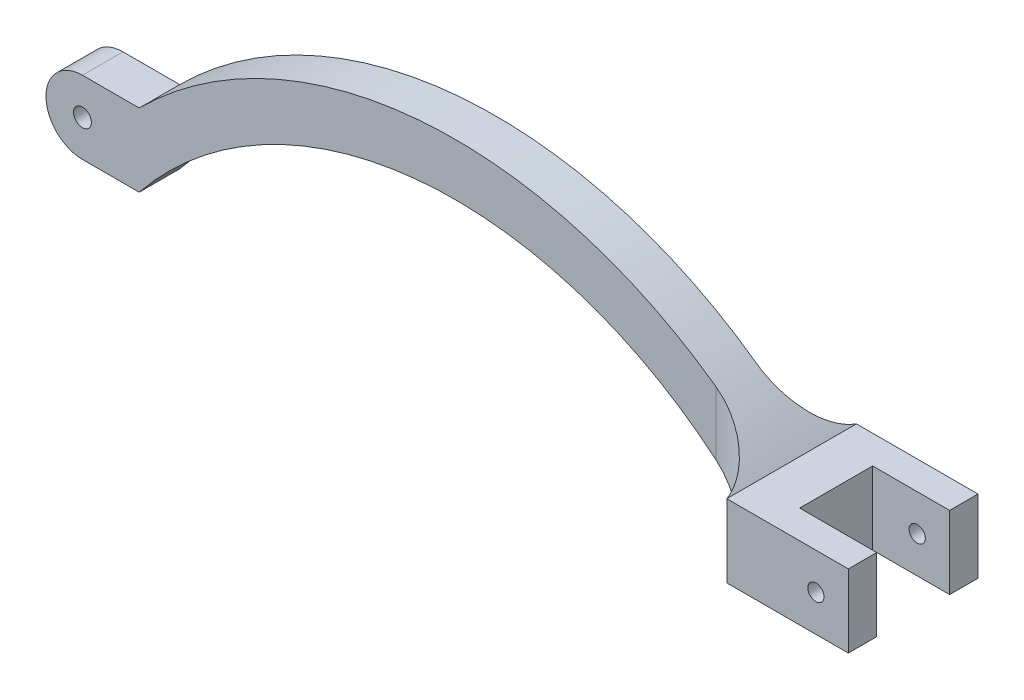
from build123d import *

# Parameters (mm, degrees)
SKETCH1_R           = 1.1
BOSS_EXTRUDE1_DEPTH = 5
BOSS_EXTRUDE2_DEPTH = 5
BOSS_EXTRUDE3_DEPTH = 9
SKETCH5_R           = 1
CUT_EXTRUDE1_DEPTH  = 16
SKETCH6_R           = 1.9
CUT_EXTRUDE2_DEPTH  = 1
FILLET1_R           = 0.5
SKETCH7_W           = 5
SKETCH7_H           = 16
BOSS_EXTRUDE4_DEPTH = 9
FILLET2_R           = 7


with BuildPart() as part:
    # Sketch1 → Boss-Extrude1 (new body)
    with BuildSketch(Plane.XY):
        with BuildLine():
            ThreePointArc((0, 4.5), (-4.5, 0), (0, -4.5))
            Line((0, -4.5), (7, -4.5))
            ThreePointArc((7, -4.5), (42.961642557, 14.118622766), (80.916317371, 0))
            Line((80.916317371, 0), (90, 0))
            Line((90, 0), (90, 4.5))
            Line((90, 4.5), (85, 4.5))
            ThreePointArc((85, 4.5), (46, 20.654328933), (7, 4.5))
            Line((7, 4.5), (0, 4.5))
        make_face()
        Circle(SKETCH1_R, mode=Mode.SUBTRACT)
    extrude(amount=BOSS_EXTRUDE1_DEPTH)

    # Sketch3 → Boss-Extrude2 (add)
    with BuildSketch(Plane.XY.offset(5)):
        Polygon((90, 0), (90, -4.5), (85, -4.5), (80.916317371, 0), align=None)
    extrude(amount=-BOSS_EXTRUDE2_DEPTH)

    # Sketch4 → Boss-Extrude3 (add)
    with BuildSketch(Plane(origin=(0, 4.5, 0), x_dir=(1, 0, 0), z_dir=(0, 1, 0))):
        Polygon((90.5, 2), (100, 2), (100, 5.5), (90, 5.5), (90, 0), (90, -5), (90, -10.5), (100, -10.5), (100, -7), (90.5, -7), align=None)
    extrude(amount=-BOSS_EXTRUDE3_DEPTH)

    # Sketch5 → Cut-Extrude1 (cut)
    with BuildSketch(Plane(origin=(0, 0, -5.5), x_dir=(-1, 0, 0), z_dir=(0, 0, -1))):
        with Locations((-96, 0)):
            Circle(SKETCH5_R)
    extrude(amount=-CUT_EXTRUDE1_DEPTH, mode=Mode.SUBTRACT)

    # Sketch6 → Cut-Extrude2 (cut)
    with BuildSketch(Plane(origin=(0, 0, -5.5), x_dir=(-1, 0, 0), z_dir=(0, 0, -1))):
        with Locations((-96, 0)):
            Circle(SKETCH6_R)
    extrude(amount=-CUT_EXTRUDE2_DEPTH, mode=Mode.SUBTRACT)

    # Fillet1
    fillet1_edges = [part.edges().sort_by_distance(p)[0] for p in [
        (97, 0, 7),
    ]]
    fillet(fillet1_edges, radius=FILLET1_R)

    # Sketch7 → Boss-Extrude4 (add)
    with BuildSketch(Plane.XZ.offset(4.5)):
        with Locations((87.5, 2.5)):
            Rectangle(SKETCH7_W, SKETCH7_H)
    extrude(amount=-BOSS_EXTRUDE4_DEPTH)

    # Fillet2
    # the kernel refuses this fillet: 7 mm, written as the material it adds along each edge
    with BuildSketch(Plane(origin=(85, 21.593492914, 0), x_dir=(0, 0, -1), z_dir=(0, -1, 0))) as fillet2_piece_1_section:
        with BuildLine():
            CenterArc((7, -6.837397166), FILLET2_R, 102.373625116, 77.626374884)
            Line((0, -6.837397166), (0, 0))
            Line((0, 0), (5.5, 0))
        make_face()
    fillet2_piece_1 = extrude(amount=43.186985828, mode=Mode.PRIVATE)
    fillet2_piece_1 = fillet2_piece_1 & Plane(origin=(46, -34.5, 0), x_dir=(0.7071067811865476, 0.7071067811865476, 0), z_dir=(0, 0, -1)) * Cylinder(55.154328933, 114, mode=Mode.PRIVATE)
    fillet2_piece_1 = split(fillet2_piece_1, bisect_by=Plane(origin=(72.014490495, 9.809337449, 0), z_dir=(0.7405316990978602, 0.6720214301874877, 0)), keep=Keep.TOP, mode=Mode.PRIVATE)
    add(fillet2_piece_1)
    with BuildSketch(Plane(origin=(85, 4.5, 0), x_dir=(0, 0, -1), z_dir=(0, -1, 0))) as fillet2_piece_2_section:
        with BuildLine():
            CenterArc((7, -6.837397166), FILLET2_R, 102.373625116, 77.626374884)
            Line((0, -6.837397166), (0, 0))
            Line((0, 0), (5.5, 0))
        make_face()
    fillet2_piece_2 = extrude(amount=26.093492914, mode=Mode.PRIVATE)
    fillet2_piece_2 = fillet2_piece_2 - Plane(origin=(46, -35.788975694, 0), x_dir=(-0.7799999999999994, 0.6257795138864816, 0), z_dir=(0, 0, -1)) * Cylinder(50, 80, mode=Mode.PRIVATE)
    add(fillet2_piece_2)
    with BuildSketch(Plane(origin=(85, 21.593492914, 5), x_dir=(-1, 0, 0), z_dir=(0, -1, 0))) as fillet2_piece_3_section:
        with BuildLine():
            CenterArc((6.837397166, -7), FILLET2_R, 90, 77.626374884)
            Line((0, -5.5), (0, 0))
            Line((0, 0), (6.837397166, 0))
        make_face()
    fillet2_piece_3 = extrude(amount=43.186985828, mode=Mode.PRIVATE)
    fillet2_piece_3 = fillet2_piece_3 & Plane(origin=(46, -34.5, 5), x_dir=(0.7071067811865476, 0.7071067811865476, 0), z_dir=(0, 0, -1)) * Cylinder(55.154328933, 114, mode=Mode.PRIVATE)
    fillet2_piece_3 = split(fillet2_piece_3, bisect_by=Plane(origin=(72.014490495, 9.809337449, 5), z_dir=(0.7405316990978602, 0.6720214301874877, 0)), keep=Keep.TOP, mode=Mode.PRIVATE)
    add(fillet2_piece_3)
    with BuildSketch(Plane(origin=(85, 4.5, 5), x_dir=(-1, 0, 0), z_dir=(0, -1, 0))) as fillet2_piece_4_section:
        with BuildLine():
            CenterArc((6.837397166, -7), FILLET2_R, 90, 77.626374884)
            Line((0, -5.5), (0, 0))
            Line((0, 0), (6.837397166, 0))
        make_face()
    fillet2_piece_4 = extrude(amount=26.093492914, mode=Mode.PRIVATE)
    fillet2_piece_4 = fillet2_piece_4 - Plane(origin=(46, -35.788975694, 5), x_dir=(-0.7799999999999994, 0.6257795138864816, 0), z_dir=(0, 0, -1)) * Cylinder(50, 80, mode=Mode.PRIVATE)
    add(fillet2_piece_4)


solid = part.part
